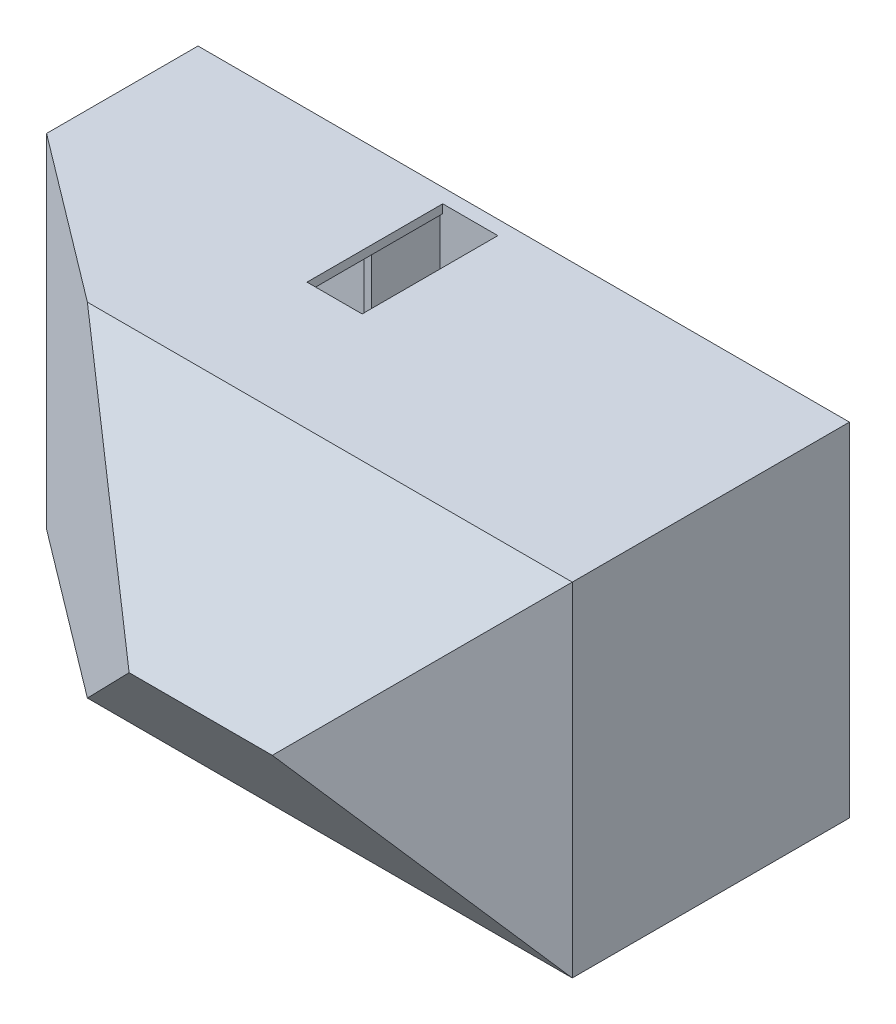
from build123d import *

# Parameters (mm, degrees)
SKETCH3_W                        = 11582.4
SKETCH3_H                        = 6096
SKETCH3_W_2                      = 3708.4
SKETCH3_H_2                      = 2342.798643186
SKETCH3_H_3                      = 2330.801356814
BOSS_EXTRUDE1_DEPTH              = 2438.4
SKETCH4_W                        = 11582.4
SKETCH4_H                        = 6096
BOSS_EXTRUDE2_DEPTH              = 254
BOSS_EXTRUDE3_DEPTH              = 914.4
SKETCH9_W                        = 865.543163862
SKETCH9_H                        = 991.415413209
CUT_EXTRUDE1_DEPTH               = 308.356
BOSS_EXTRUDE4_REACH              = 13183.499
BOSS_EXTRUDE7_DEPTH              = 254
BOSS_EXTRUDE7_DEPTH_BACK         = 25.4
CUT_EXTRUDE2_REACH               = 12509.597
BOSS_EXTRUDE8_DEPTH              = 1981.2
BOSS_EXTRUDE9_DEPTH              = 152.4
BOSS_EXTRUDE10_DEPTH             = 11509.502
BOSS_EXTRUDE11_REACH             = 14825.941
SKETCH17_W                       = 9126.052100072
SKETCH17_H                       = 6096
CUT_EXTRUDE3_DEPTH               = 3950.208
SKETCH18_W                       = 6162.012197425
SKETCH18_H                       = 5468.61546298
CUT_EXTRUDE4_DEPTH               = 3950.208
SKETCH19_W                       = 10778.647149002
SKETCH19_H                       = 6356.86992093
CUT_EXTRUDE5_DEPTH               = 3950.208
BOSS_EXTRUDE12_REACH             = 13849.543
SKETCH20_W                       = 3454.4
SKETCH20_H                       = 101.6
BOSS_EXTRUDE13_REACH             = 13849.543
SKETCH21_W                       = 101.6
SKETCH21_H                       = 1651
SKETCH22_W                       = 532.624565481
SKETCH22_H                       = 1281.986841564
CUT_EXTRUDE7_DEPTH               = 1185.672
SKETCH23_W                       = 128.189543518
SKETCH23_H                       = 2423.836870905
BOSS_EXTRUDE14_DEPTH             = 1219.2
BOSS_EXTRUDE15_REACH             = 14294.145
SKETCH24_W                       = 128.189543518
SKETCH24_H                       = 134.329985605
BOSS_EXTRUDE18_DEPTH             = 2399.284
BOSS_EXTRUDE18_DEPTH_BACK        = 2122.678
SKETCH26_W                       = 128.189543518
SKETCH26_H                       = 159.351168061
BOSS_EXTRUDE19_DEPTH             = 4241.8
BOSS_EXTRUDE19_DEPTH_BACK        = 3574.034
SKETCH27_W                       = 159.351168061
SKETCH27_H                       = 134.329985605
SKETCH33_W                       = 159.351168061
SKETCH33_H                       = 110.164485909
BOSS_EXTRUDE22_DEPTH             = 2592.07
BOSS_EXTRUDE23_DEPTH             = 2412.746
BOSS_EXTRUDE23_DEPTH_BACK        = 3589.528
SKETCH34_W                       = 128.189543518
SKETCH34_H                       = 150.52485229
BOSS_EXTRUDE24_REACH             = 11698.577
SKETCH35_W                       = 147.733032468
SKETCH35_H                       = 225.221764686
BOSS_EXTRUDE24_DIRECTION_2_DEPTH = 3311.398
SKETCH36_W                       = 117.495674419
SKETCH36_H                       = 147.733032468
BOSS_EXTRUDE25_DEPTH             = 2412.746
BOSS_EXTRUDE26_REACH             = 13768.706
SKETCH37_W                       = 172.313632774
SKETCH37_H                       = 139.095631101
BOSS_EXTRUDE27_DEPTH             = 3289.554
BOSS_EXTRUDE27_DEPTH_BACK        = 2668.016
SKETCH42_W                       = 172.313632774
SKETCH42_H                       = 147.733032468
SKETCH43_W                       = 171.607694654
SKETCH43_H                       = 159.351168061
BOSS_EXTRUDE28_DEPTH             = 3409.442
BOSS_EXTRUDE29_START             = 3519.763129095
BOSS_EXTRUDE29_DEPTH             = 134.329985605
SKETCH25_W                       = 5842
SKETCH25_H                       = 152.4
BOSS_EXTRUDE17_DEPTH             = 2235.2
BOSS_EXTRUDE20_REACH             = 14825.941
SKETCH29_W                       = 4249.880047705
SKETCH29_H                       = 6867.48766491
CUT_EXTRUDE8_DEPTH               = 4333.494
SKETCH30_W                       = 5475.233712052
SKETCH30_H                       = 5083.463062498
CUT_EXTRUDE9_DEPTH               = 4333.494
SKETCH31_W                       = 5267.827918063
SKETCH31_H                       = 4526.494518998
CUT_EXTRUDE10_DEPTH              = 4333.494
BOSS_EXTRUDE21_DEPTH             = 2687.32
SKETCH38_W                       = 5170.59012186
SKETCH38_H                       = 1946.673235559
CUT_EXTRUDE11_DEPTH              = 2412.746
SKETCH39_W                       = 8812.500446969
SKETCH39_H                       = 7026.305940655
CUT_EXTRUDE12_DEPTH              = 2412.746
SKETCH40_W                       = 7455.191850554
SKETCH40_H                       = 6034.724471262
CUT_EXTRUDE13_DEPTH              = 2412.746
SKETCH41_W                       = 6175.122976302
SKETCH41_H                       = 7375.841332805
CUT_EXTRUDE14_DEPTH              = 2412.746
SKETCH45_W                       = 5842
SKETCH45_H                       = 152.4
BOSS_EXTRUDE30_DEPTH             = 2235.2
SKETCH46_W                       = 6467.572168299
SKETCH46_H                       = 1492.516654223
CUT_EXTRUDE15_DEPTH              = 2235.2
SKETCH47_W                       = 980.476105055
SKETCH47_H                       = 2413
CUT_EXTRUDE16_DEPTH              = 2235.2
SKETCH48_W                       = 980.476105055
SKETCH48_H                       = 2413
CUT_EXTRUDE17_DEPTH              = 463.804
SKETCH49_W                       = 841.116574167
SKETCH49_H                       = 2290.952430173
CUT_EXTRUDE18_DEPTH              = 463.804
SKETCH50_W                       = 859.629187762
SKETCH50_H                       = 2304.601646796
CUT_EXTRUDE19_DEPTH              = 463.804
SKETCH51_W                       = 859.629187762
SKETCH51_H                       = 2304.601646796
CUT_EXTRUDE20_DEPTH              = 463.804
SKETCH52_W                       = 926.009779554
SKETCH52_H                       = 2273.025271102
CUT_EXTRUDE21_DEPTH              = 463.804


# Read off the part's stored shape, not the designer's step: Boss-Extrude29
with BuildPart() as part:
    # Sketch3 → Boss-Extrude1 (new body)
    with BuildSketch(Plane.XY):
        with Locations((5791.2, 3048)):
            Rectangle(SKETCH3_W, SKETCH3_H)
        Polygon((6096, 2495.198643186), (7620, 2495.198643186), (7620, 152.4), (7421.082242954, 152.4), (6096, 152.4), align=None, mode=Mode.SUBTRACT)
        with Locations((9575.8, 1323.799321593)):
            Rectangle(SKETCH3_W_2, SKETCH3_H_2, mode=Mode.SUBTRACT)
        Polygon((4452.687217937, 152.4), (152.4, 152.4), (152.4, 2489.2), (3454.4, 2489.2), (3454.4, 2590.8), (152.4, 2590.8), (152.4, 5943.6), (5973.282242954, 5943.6), (6074.882242954, 5943.6), (7620, 5943.6), (7620, 3621.363129095), (7620, 3519.763129095), (10289.03652981, 3519.763129095), (10390.63652981, 3519.763129095), (11430, 3511.198643186), (11430, 2596.798643186), (10390.63652981, 2605.363129095), (10289.03652981, 2605.363129095), (7620, 2605.363129095), (5994.4, 2605.363129095), (5994.4, 152.4), (4554.287217937, 152.4), (4554.287217937, 1803.4), (4452.687217937, 1803.4), align=None, mode=Mode.SUBTRACT)
        with Locations((9575.8, 4778.199321593)):
            Rectangle(SKETCH3_W_2, SKETCH3_H_3, mode=Mode.SUBTRACT)
    extrude(amount=BOSS_EXTRUDE1_DEPTH)

    # Sketch4 → Boss-Extrude2 (add)
    with BuildSketch(Plane(origin=(0, 0, 0), x_dir=(-1, 0, 0), z_dir=(0, 0, -1))):
        with Locations((-5791.2, 3048)):
            Rectangle(SKETCH4_W, SKETCH4_H)
    extrude(amount=BOSS_EXTRUDE2_DEPTH)

    # Sketch8 → Boss-Extrude3 (add)
    with BuildSketch(Plane.XZ.offset(-3519.763129095)):
        Polygon((8686.8, 0), (9986.551476605, 1788.954433505), (10397.644155821, 2354.774964816), (11430, 2354.774964816), (11430, 2226.612273299), (10461.509143073, 2226.612273299), (10046.955380129, 1656.027968919), (8843.780633142, 0), align=None)
    extrude(amount=BOSS_EXTRUDE3_DEPTH)

    # Sketch9 → Cut-Extrude1 (cut)
    with BuildSketch(Plane(origin=(22.172535688, 2690.800578374, 0), x_dir=(0.9999660518909057, -0.008239846219105333, 0), z_dir=(0.008239846219105333, 0.9999660518909057, 0))):
        with Locations((10967.071485942, -1942.692293396)):
            Rectangle(SKETCH9_W, SKETCH9_H)
    extrude(amount=-CUT_EXTRUDE1_DEPTH, mode=Mode.SUBTRACT)

    # Boss-Extrude4: up to this plane
    boss_extrude4_end = Plane(origin=(10553.574014115, 2295.654035243, 1446.984586791), z_dir=(-0.9999660518909057, 0.008239846219105333, 0))
    # Sketch10 → Boss-Extrude4 (add, up to the surface)
    with BuildSketch(Plane.ZY.offset(-11430), mode=Mode.PRIVATE) as boss_extrude4_sk1:
        Polygon((1446.984586791, 2605.363129095), (2438.4, 1423.840248649), (2438.4, 1313.675762741), (1446.984586791, 2495.198643186), (1319.984586791, 2495.198643186), (1319.984586791, 2605.363129095), align=None)
    boss_extrude4_tool1 = split(extrude(boss_extrude4_sk1.sketch, amount=BOSS_EXTRUDE4_REACH, mode=Mode.PRIVATE), bisect_by=boss_extrude4_end, keep=Keep.BOTH, mode=Mode.PRIVATE)
    add(boss_extrude4_tool1.solids().sort_by_distance((11430, 2026.602483, 1879.192293))[0])

    # Sketch11 → Boss-Extrude7 (add, two sides: drawn at the far end of the back side and taken through both)
    with BuildSketch(Plane.XY.offset(2438.4).offset(-BOSS_EXTRUDE7_DEPTH_BACK)):
        Polygon((5994.4, 2605.363129095), (5994.4, 0), (11582.4, 0), (11582.4, 1423.840248649), (11582.4, 3612.798643186), (11582.4, 6096), (7620, 6096), (5994.4, 6096), (5994.4, 5943.6), (7620, 5943.6), (7620, 3519.763129095), (7620, 2605.363129095), align=None)
        Polygon((11430, 1423.840248649), (10546.390158704, 1423.840248649), (10556.114820136, 2603.999567139), (9336.915582645, 2605.363129095), (9336.915582645, 3519.763129095), (11430, 3511.198643186), align=None, mode=Mode.SUBTRACT)
    extrude(amount=BOSS_EXTRUDE7_DEPTH + BOSS_EXTRUDE7_DEPTH_BACK)

    # Cut-Extrude2: up to this plane
    cut_extrude2_end = Plane(origin=(11430, 0, 2438.4), z_dir=(-1, 0, 0))
    # Sketch12 → Cut-Extrude2 (cut, up to the surface)
    with BuildSketch(Plane(origin=(10533.942284448, -86.801011235, 0), x_dir=(0, 0, -1), z_dir=(0.9999660518909057, -0.008239846219105333, 0)), mode=Mode.PRIVATE) as cut_extrude2_sk1:
        Polygon((-2438.4, 1519.229106813), (-2692.4, 1216.533970571), (-2692.4, 1519.229106813), align=None)
    cut_extrude2_tool1 = split(extrude(cut_extrude2_sk1.sketch, amount=CUT_EXTRUDE2_REACH, mode=Mode.PRIVATE), bisect_by=cut_extrude2_end, keep=Keep.BOTH, mode=Mode.PRIVATE)
    add(cut_extrude2_tool1.solids().sort_by_distance((10545.629112, 1331.481567, 2607.733333))[0], mode=Mode.SUBTRACT)

    # Sketch13 → Boss-Extrude8 (add)
    with BuildSketch(Plane.XY.offset(2692.4)):
        Polygon((7620, 6096), (11582.4, 6096), (11582.4, 3511.198643186), (11582.4, 0), (5994.4, 0), (5994.4, 152.4), (11430, 152.4), (11430, 3511.198643186), (9336.915582645, 3519.763129095), (9336.915582645, 2605.363129095), (7620, 2605.363129095), (7620, 5943.6), (5994.4, 5943.6), (5994.4, 6096), align=None)
        Polygon((7721.6, 2706.963129095), (7721.6, 5943.6), (11430, 5943.6), (11430, 3613.380649927), (9235.315582645, 3621.751379922), (9235.315582645, 2706.963129095), align=None, mode=Mode.SUBTRACT)
    extrude(amount=BOSS_EXTRUDE8_DEPTH)

    # Sketch14 → Boss-Extrude9 (add)
    with BuildSketch(Plane(origin=(11582.4, 0, 0), x_dir=(0, 0, -1), z_dir=(1, 0, 0))):
        Polygon((-4673.6, 0), (-4673.6, 6096), (-6959.6, 3048), align=None)
    extrude(amount=-BOSS_EXTRUDE9_DEPTH)

    # Sketch15 → Boss-Extrude10 (add)
    with BuildSketch(Plane.ZY.offset(-11430)):
        Polygon((4673.6, 6096), (6959.6, 3048), (4673.6, 0), (4673.6, 152.4), (6845.3, 3048), (4673.6, 5943.6), align=None)
    extrude(amount=BOSS_EXTRUDE10_DEPTH)

    # Boss-Extrude11: up to this face of the body (flat: up to its plane)
    boss_extrude11_end = Plane(part.part.faces().sort_by_distance((6648.35244623, 6096, 1796.808366816))[0])
    # Sketch16 → Boss-Extrude11 (add, up to the picked face)
    with BuildSketch(Plane.XZ, mode=Mode.PRIVATE) as boss_extrude11_sk1:
        Polygon((0, 2438.4), (5988.840887926, 6959.6), (5988.840887926, 6845.3), (152.4, 2438.4), align=None)
    boss_extrude11_tool1 = split(extrude(boss_extrude11_sk1.sketch, amount=-BOSS_EXTRUDE11_REACH, mode=Mode.PRIVATE), bisect_by=boss_extrude11_end, keep=Keep.BOTH, mode=Mode.PRIVATE)
    add(boss_extrude11_tool1.solids().sort_by(Axis((3029.082751, 0, 4668.075048), (0, 1, 0)))[0])

    # Sketch17 → Cut-Extrude3 (cut)
    with BuildSketch(Plane(origin=(-1172.561069115, 0, 1553.189789061), x_dir=(0.7981045533386113, 0, 0.6025189805642441), z_dir=(-0.6025189805642441, 0, 0.7981045533386113))):
        with Locations((4409.986228973, 3048)):
            Rectangle(SKETCH17_W, SKETCH17_H)
    extrude(amount=CUT_EXTRUDE3_DEPTH, mode=Mode.SUBTRACT)

    # Sketch18 → Cut-Extrude4 (cut)
    with BuildSketch(Plane(origin=(0, -2243.328, 2991.104), x_dir=(1, 0, 0), z_dir=(0, -0.6000000000000001, 0.7999999999999998))):
        with Locations((4789.474642924, 4319.26773149)):
            Rectangle(SKETCH18_W, SKETCH18_H)
    extrude(amount=CUT_EXTRUDE4_DEPTH, mode=Mode.SUBTRACT)

    # Sketch19 → Cut-Extrude5 (cut)
    with BuildSketch(Plane(origin=(0, 4437.888, 5917.184), x_dir=(1, 0, 0), z_dir=(0, 0.5999999999999998, 0.8000000000000004))):
        with Locations((7188.072546938, 83.612963585)):
            Rectangle(SKETCH19_W, SKETCH19_H)
    extrude(amount=CUT_EXTRUDE5_DEPTH, mode=Mode.SUBTRACT)

    # Boss-Extrude12: up to this face of the body (flat: up to its plane)
    boss_extrude12_end = Plane(part.part.faces().sort_by_distance((2402.66330701, 3048, 4137.498056176))[0])
    # Sketch20 → Boss-Extrude12 (add, up to the picked face)
    with BuildSketch(Plane.XY.offset(2438.4), mode=Mode.PRIVATE) as boss_extrude12_sk1:
        with Locations((1727.2, 2540)):
            Rectangle(SKETCH20_W, SKETCH20_H)
    boss_extrude12_tool1 = split(extrude(boss_extrude12_sk1.sketch, amount=BOSS_EXTRUDE12_REACH, mode=Mode.PRIVATE), bisect_by=boss_extrude12_end, keep=Keep.BOTH, mode=Mode.PRIVATE)
    add(boss_extrude12_tool1.solids().sort_by(Axis((1727.2, 2540, 2438.4), (0, 0, 1)))[0])

    # Boss-Extrude13: up to this plane
    boss_extrude13_end = Plane(origin=(11430, 0, 4673.6), z_dir=(0, -0.6000000000000002, 0.7999999999999999))
    # Sketch21 → Boss-Extrude13 (add, up to the surface)
    with BuildSketch(Plane.XY.offset(2438.4), mode=Mode.PRIVATE) as boss_extrude13_sk1:
        with Locations((4503.487217937, 977.9)):
            Rectangle(SKETCH21_W, SKETCH21_H)
    boss_extrude13_tool1 = split(extrude(boss_extrude13_sk1.sketch, amount=BOSS_EXTRUDE13_REACH, mode=Mode.PRIVATE), bisect_by=boss_extrude13_end, keep=Keep.BOTH, mode=Mode.PRIVATE)
    add(boss_extrude13_tool1.solids().sort_by_distance((4503.487218, 977.9, 2438.4))[0])

    # Sketch22 → Cut-Extrude7 (cut)
    with BuildSketch(Plane(origin=(-1172.561069115, 0, 1553.189789061), x_dir=(0.7981045533386113, 0, 0.6025189805642441), z_dir=(-0.6025189805642441, 0, 0.7981045533386113))):
        with Locations((7037.092924102, 1579.089259508)):
            Rectangle(SKETCH22_W, SKETCH22_H)
    extrude(amount=CUT_EXTRUDE7_DEPTH, mode=Mode.SUBTRACT)

    # Sketch23 → Boss-Extrude14 (add)
    with BuildSketch(Plane.XY):
        with Locations((4490.192446178, 4731.681564547)):
            Rectangle(SKETCH23_W, SKETCH23_H)
    extrude(amount=BOSS_EXTRUDE14_DEPTH)

    # Boss-Extrude15: up to this plane
    boss_extrude15_end = Plane(origin=(152.4, 13599.829996801, 2438.4), z_dir=(0.6025845157633412, 0, -0.7980550741410393))
    # Sketch24 → Boss-Extrude15 (add, up to the surface)
    with BuildSketch(Plane.XY.offset(1219.2), mode=Mode.PRIVATE) as boss_extrude15_sk1:
        with Locations((4490.192446178, 3586.928121898)):
            Rectangle(SKETCH24_W, SKETCH24_H)
    boss_extrude15_tool1 = split(extrude(boss_extrude15_sk1.sketch, amount=BOSS_EXTRUDE15_REACH, mode=Mode.PRIVATE), bisect_by=boss_extrude15_end, keep=Keep.BOTH, mode=Mode.PRIVATE)
    add(boss_extrude15_tool1.solids().sort_by_distance((4490.192446, 3586.928122, 1219.2))[0])

    # Sketch26 → Boss-Extrude18 (add, two sides: drawn at the far end of the back side and taken through both)
    with BuildSketch(Plane(origin=(0, 3654.0931147, 0), x_dir=(1, 0, 0), z_dir=(0, 1, 0)).offset(-BOSS_EXTRUDE18_DEPTH_BACK)):
        with Locations((4490.192446178, -2492.67558403)):
            Rectangle(SKETCH26_W, SKETCH26_H)
    extrude(amount=BOSS_EXTRUDE18_DEPTH + BOSS_EXTRUDE18_DEPTH_BACK)

    # Sketch27 → Boss-Extrude19 (add, two sides: drawn at the far end of the back side and taken through both)
    with BuildSketch(Plane.ZY.offset(-4426.097674419).offset(-BOSS_EXTRUDE19_DEPTH_BACK)):
        with Locations((2492.67558403, 3586.928121898)):
            Rectangle(SKETCH27_W, SKETCH27_H)
    extrude(amount=BOSS_EXTRUDE19_DEPTH + BOSS_EXTRUDE19_DEPTH_BACK)

    # Sketch33 → Boss-Extrude22 (add)
    with BuildSketch(Plane.ZY.offset(-5994.4)):
        with Locations((2492.67558403, 2550.280886141)):
            Rectangle(SKETCH33_W, SKETCH33_H)
    extrude(amount=BOSS_EXTRUDE22_DEPTH)

    # Sketch34 → Boss-Extrude23 (add, two sides: drawn at the far end of the back side and taken through both)
    with BuildSketch(Plane(origin=(0, 3654.0931147, 0), x_dir=(1, 0, 0), z_dir=(0, 1, 0)).offset(-BOSS_EXTRUDE23_DEPTH_BACK)):
        with Locations((4490.192446178, -4598.337573855)):
            Rectangle(SKETCH34_W, SKETCH34_H)
    extrude(amount=BOSS_EXTRUDE23_DEPTH + BOSS_EXTRUDE23_DEPTH_BACK)

    # Boss-Extrude24: up to this plane
    boss_extrude24_end = Plane(origin=(152.4, 13599.829996801, 2438.4), z_dir=(0.6025845157633412, 0, -0.7980550741410393))
    # Sketch35 → Boss-Extrude24 (add, up to the surface)
    with BuildSketch(Plane.ZY.offset(-4426.097674419), mode=Mode.PRIVATE) as boss_extrude24_sk1:
        with Locations((4599.733483766, 2601.810882343)):
            Rectangle(SKETCH35_W, SKETCH35_H)
    boss_extrude24_tool1 = split(extrude(boss_extrude24_sk1.sketch, amount=BOSS_EXTRUDE24_REACH, mode=Mode.PRIVATE), bisect_by=boss_extrude24_end, keep=Keep.BOTH, mode=Mode.PRIVATE)
    add(boss_extrude24_tool1.solids().sort_by_distance((4426.097674, 2601.810882, 4599.733484))[0])

    # Sketch35 → Boss-Extrude24 direction 2 (add)
    with BuildSketch(Plane.ZY.offset(-4426.097674419)):
        with Locations((4599.733483766, 2601.810882343)):
            Rectangle(SKETCH35_W, SKETCH35_H)
    extrude(amount=-BOSS_EXTRUDE24_DIRECTION_2_DEPTH)

    # Sketch36 → Boss-Extrude25 (add)
    with BuildSketch(Plane.XZ.offset(-2489.2)):
        with Locations((7678.74783721, 4599.733483766)):
            Rectangle(SKETCH36_W, SKETCH36_H)
    extrude(amount=BOSS_EXTRUDE25_DEPTH)

    # Boss-Extrude26: up to this plane
    boss_extrude26_end = Plane(origin=(-79.502, 152.4, 4673.6), z_dir=(0, -0.5999999999999998, 0.8000000000000003))
    # Sketch37 → Boss-Extrude26 (add, up to the surface)
    with BuildSketch(Plane.XY.offset(2692.4), mode=Mode.PRIVATE) as boss_extrude26_sk1:
        with Locations((6080.556816387, 2535.815313544)):
            Rectangle(SKETCH37_W, SKETCH37_H)
    boss_extrude26_tool1 = split(extrude(boss_extrude26_sk1.sketch, amount=BOSS_EXTRUDE26_REACH, mode=Mode.PRIVATE), bisect_by=boss_extrude26_end, keep=Keep.BOTH, mode=Mode.PRIVATE)
    add(boss_extrude26_tool1.solids().sort_by_distance((6080.556816, 2535.815314, 2692.4))[0])

    # Sketch42 → Boss-Extrude27 (add, two sides: drawn at the far end of the back side and taken through both)
    with BuildSketch(Plane(origin=(0, 2714.421764686, 0), x_dir=(1, 0, 0), z_dir=(0, 1, 0)).offset(-BOSS_EXTRUDE27_DEPTH_BACK)):
        with Locations((6080.556816387, -4599.733483766)):
            Rectangle(SKETCH42_W, SKETCH42_H)
    extrude(amount=BOSS_EXTRUDE27_DEPTH + BOSS_EXTRUDE27_DEPTH_BACK)

    # Sketch43 → Boss-Extrude28 (add)
    with BuildSketch(Plane(origin=(0, 2605.363129095, 0), x_dir=(1, 0, 0), z_dir=(0, 1, 0))):
        with Locations((6080.203847327, -2492.67558403)):
            Rectangle(SKETCH43_W, SKETCH43_H)
    extrude(amount=BOSS_EXTRUDE28_DEPTH)

    # Boss-Extrude29 outline → Boss-Extrude29 (add)
    with BuildSketch(Plane(origin=(0, 0, 0), x_dir=(1, 0, 0), z_dir=(0, 1, 0)).offset(BOSS_EXTRUDE29_START)):
        Polygon((2913.316578578, -4523.07514771), (3112.669729899, -4673.6), (4426.097674419, -4673.6), (4426.097674419, -4523.07514771), align=None)
        Polygon((4554.287217937, -4673.6), (5994.4, -4673.6), (5994.4, -4525.866967532), (6166.713632774, -4525.866967532), (6166.713632774, -4673.6), (7620, -4673.6), (7620, -4523.07514771), (4554.287217937, -4523.07514771), align=None)
    extrude(amount=BOSS_EXTRUDE29_DEPTH)

    # Sketch25 → Boss-Extrude17 (add)
    with BuildSketch(Plane.XY.offset(2438.4)):
        with Locations((3073.4, 76.2)):
            Rectangle(SKETCH25_W, SKETCH25_H)
    extrude(amount=BOSS_EXTRUDE17_DEPTH)

    # Boss-Extrude20: up to this face of the body (flat: up to its plane)
    boss_extrude20_end = Plane(part.part.faces().sort_by_distance((5824.630568399, 0, 2201.759416204))[0])
    # Sketch28 → Boss-Extrude20 (add, up to the picked face)
    with BuildSketch(Plane(origin=(0, 6096, 0), x_dir=(1, 0, 0), z_dir=(0, 1, 0)), mode=Mode.PRIVATE) as boss_extrude20_sk1:
        Polygon((11582.4, -4673.6), (11277.6, -4902.2), (8534.4, -6959.6), (8382, -6959.6), (11430, -4673.6), align=None)
    boss_extrude20_tool1 = split(extrude(boss_extrude20_sk1.sketch, amount=-BOSS_EXTRUDE20_REACH, mode=Mode.PRIVATE), bisect_by=boss_extrude20_end, keep=Keep.BOTH, mode=Mode.PRIVATE)
    add(boss_extrude20_tool1.solids().sort_by(Axis((9982.2, 6096, 5816.6), (0, -1, 0)))[0])

    # Sketch29 → Cut-Extrude8 (cut)
    with BuildSketch(Plane(origin=(6412.992, 0, 8550.656), x_dir=(0.8, 0, -0.6), z_dir=(0.6, 0, 0.8))):
        with Locations((4676.549859137, 2949.190131975)):
            Rectangle(SKETCH29_W, SKETCH29_H)
    extrude(amount=CUT_EXTRUDE8_DEPTH, mode=Mode.SUBTRACT)

    # Sketch30 → Cut-Extrude9 (cut)
    with BuildSketch(Plane(origin=(0, -2243.328, 2991.104), x_dir=(1, 0, 0), z_dir=(0, -0.6000000000000003, 0.7999999999999999))):
        with Locations((9740.965191179, 4457.506746783)):
            Rectangle(SKETCH30_W, SKETCH30_H)
    extrude(amount=CUT_EXTRUDE9_DEPTH, mode=Mode.SUBTRACT)

    # Sketch31 → Cut-Extrude10 (cut)
    with BuildSketch(Plane(origin=(0, 4437.888, 5917.184), x_dir=(1, 0, 0), z_dir=(0, 0.6, 0.8))):
        with Locations((9855.451340757, 112.743501572)):
            Rectangle(SKETCH31_W, SKETCH31_H)
    extrude(amount=CUT_EXTRUDE10_DEPTH, mode=Mode.SUBTRACT)

    # Sketch32 → Boss-Extrude21 (add)
    with BuildSketch(Plane.XY.offset(4673.6)):
        Polygon((7620, 5943.6), (7620, 2605.363129095), (9336.915582645, 2605.363129095), (9336.915582645, 3519.763129095), (11430, 3511.198643186), (11430, 3613.380649927), (9235.315582645, 3621.751379922), (9235.315582645, 2706.963129095), (7721.6, 2706.963129095), (7721.6, 5943.6), align=None)
    extrude(amount=BOSS_EXTRUDE21_DEPTH)

    # Sketch38 → Cut-Extrude11 (cut)
    with BuildSketch(Plane(origin=(-1172.561069115, 0, 1553.189789061), x_dir=(0.7981045533386111, 0, 0.6025189805642442), z_dir=(-0.6025189805642442, 0, 0.7981045533386111))):
        with Locations((3185.033968182, 16.696326161)):
            Rectangle(SKETCH38_W, SKETCH38_H)
    extrude(amount=CUT_EXTRUDE11_DEPTH, mode=Mode.SUBTRACT)

    # Sketch39 → Cut-Extrude12 (cut)
    with BuildSketch(Plane(origin=(0, 4437.888, 5917.184), x_dir=(1, 0, 0), z_dir=(0, 0.6, 0.8))):
        with Locations((8852.798105875, 1700.649303399)):
            Rectangle(SKETCH39_W, SKETCH39_H)
    extrude(amount=CUT_EXTRUDE12_DEPTH, mode=Mode.SUBTRACT)

    # Sketch40 → Cut-Extrude13 (cut)
    with BuildSketch(Plane(origin=(0, -2243.328, 2991.104), x_dir=(1, 0, 0), z_dir=(0, -0.6000000000000003, 0.7999999999999999))):
        with Locations((10503.513777939, 4914.283391166)):
            Rectangle(SKETCH40_W, SKETCH40_H)
    extrude(amount=CUT_EXTRUDE13_DEPTH, mode=Mode.SUBTRACT)

    # Sketch41 → Cut-Extrude14 (cut)
    with BuildSketch(Plane(origin=(6412.992, 0, 8550.656), x_dir=(0.8, 0, -0.6), z_dir=(0.6, 0, 0.8))):
        with Locations((5065.956106825, 2899.557218464)):
            Rectangle(SKETCH41_W, SKETCH41_H)
    extrude(amount=CUT_EXTRUDE14_DEPTH, mode=Mode.SUBTRACT)

    # Sketch45 → Boss-Extrude30 (add)
    with BuildSketch(Plane.XY.offset(2438.4)):
        with Locations((3073.4, 6019.8)):
            Rectangle(SKETCH45_W, SKETCH45_H)
    extrude(amount=BOSS_EXTRUDE30_DEPTH)

    # Sketch46 → Cut-Extrude15 (cut)
    with BuildSketch(Plane(origin=(-1172.561069115, 0, 1553.189789061), x_dir=(0.7981045533386111, 0, 0.6025189805642442), z_dir=(-0.6025189805642442, 0, 0.7981045533386111))):
        with Locations((2602.363649901, 6093.815626844)):
            Rectangle(SKETCH46_W, SKETCH46_H)
    extrude(amount=CUT_EXTRUDE15_DEPTH, mode=Mode.SUBTRACT)

    # Sketch47 → Cut-Extrude16 (cut)
    with BuildSketch(Plane.XZ):
        with Locations((5095.412378664, 1206.5)):
            Rectangle(SKETCH47_W, SKETCH47_H)
    extrude(amount=-CUT_EXTRUDE16_DEPTH, mode=Mode.SUBTRACT)

    # Sketch48 → Cut-Extrude17 (cut)
    with BuildSketch(Plane(origin=(0, 6096, 0), x_dir=(1, 0, 0), z_dir=(0, 1, 0))):
        with Locations((5095.412378664, -1206.5)):
            Rectangle(SKETCH48_W, SKETCH48_H)
    extrude(amount=-CUT_EXTRUDE17_DEPTH, mode=Mode.SUBTRACT)

    # Sketch49 → Cut-Extrude18 (cut)
    with BuildSketch(Plane(origin=(0, 2605.363129095, 0), x_dir=(1, 0, 0), z_dir=(0, 1, 0))):
        with Locations((6627.856212895, -1145.476215087)):
            Rectangle(SKETCH49_W, SKETCH49_H)
    extrude(amount=-CUT_EXTRUDE18_DEPTH, mode=Mode.SUBTRACT)

    # Sketch50 → Cut-Extrude19 (cut)
    with BuildSketch(Plane(origin=(0, 2605.363129095, 0), x_dir=(1, 0, 0), z_dir=(0, 1, 0))):
        with Locations((8261.394007791, -1152.300823398)):
            Rectangle(SKETCH50_W, SKETCH50_H)
    extrude(amount=-CUT_EXTRUDE19_DEPTH, mode=Mode.SUBTRACT)

    # Sketch51 → Cut-Extrude20 (cut)
    with BuildSketch(Plane.XZ.offset(-3519.763129095)):
        with Locations((8261.394007791, 1152.300823398)):
            Rectangle(SKETCH51_W, SKETCH51_H)
    extrude(amount=-CUT_EXTRUDE20_DEPTH, mode=Mode.SUBTRACT)

    # Sketch52 → Cut-Extrude21 (cut)
    with BuildSketch(Plane.XZ.offset(-2605.363129095)):
        with Locations((8677.976304577, 3828.912635551)):
            Rectangle(SKETCH52_W, SKETCH52_H)
    extrude(amount=-CUT_EXTRUDE21_DEPTH, mode=Mode.SUBTRACT)


solid = part.part
